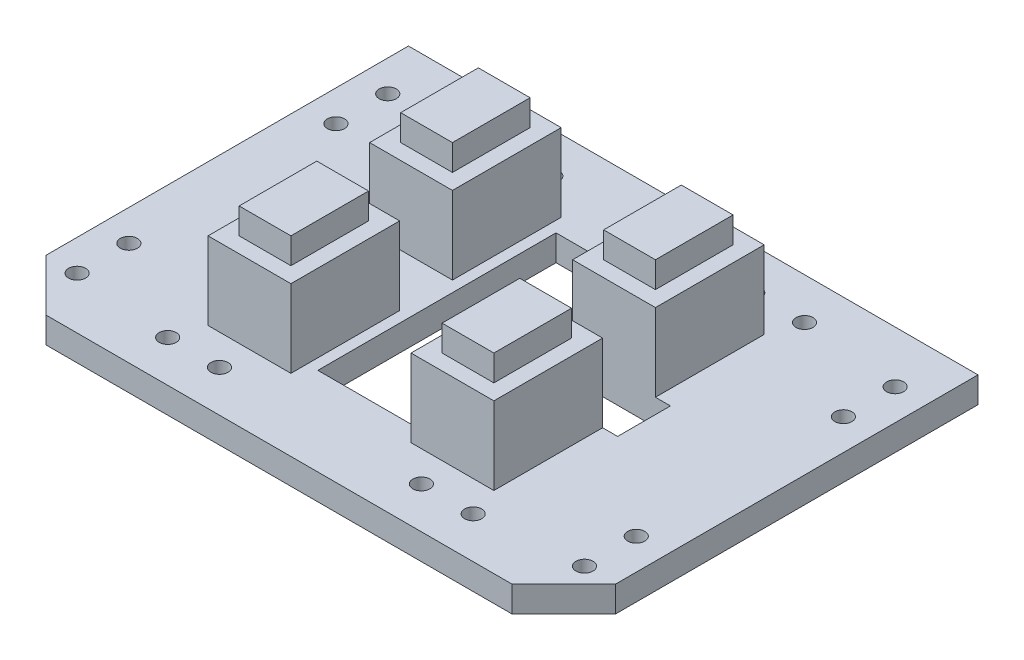
from build123d import *

# Parameters (mm, degrees)
SKETCH1_R           = 1.65
SKETCH1_W           = 19
SKETCH1_H           = 46
BOSS_EXTRUDE3_DEPTH = 5
SKETCH6_W           = 10
SKETCH6_H           = 15
BOSS_EXTRUDE4_DEPTH = 20
SKETCH8_W           = 16
SKETCH8_H           = 21
SKETCH8_W_2         = 10
SKETCH8_H_2         = 15
BOSS_EXTRUDE5_DEPTH = 15
SKETCH5_W           = 16
SKETCH5_H           = 10.2
CUT_EXTRUDE1_DEPTH  = 64.492125496
SKETCH10_W          = 12.5
SKETCH10_H          = 80
SKETCH10_R          = 1.65
BOSS_EXTRUDE6_DEPTH = 5
CHAMFER1_SIZE       = 10


with BuildPart() as part:
    # Sketch1 → Boss-Extrude3 (new body)
    with BuildSketch(Plane(origin=(0, 0, 0), x_dir=(1, 0, 0), z_dir=(0, 1, 0))):
        Polygon((42.5, 40), (-42.5, 40), (-42.5, 24.25), (-42.5, -24.25), (-42.5, -40), (-20, -40), (20, -40), (42.5, -40), (42.5, -24.25), (42.5, 24.25), align=None)
        with Locations((-29.5, -32)):
            Circle(SKETCH1_R, mode=Mode.SUBTRACT)
        with Locations((-19.5, -32)):
            Circle(SKETCH1_R, mode=Mode.SUBTRACT)
        with Locations((19.5, -32)):
            Circle(SKETCH1_R, mode=Mode.SUBTRACT)
        with Locations((29.5, -32)):
            Circle(SKETCH1_R, mode=Mode.SUBTRACT)
        Rectangle(SKETCH1_W, SKETCH1_H, mode=Mode.SUBTRACT)
        with Locations((-29.5, 32)):
            Circle(SKETCH1_R, mode=Mode.SUBTRACT)
        with Locations((-19.5, 32)):
            Circle(SKETCH1_R, mode=Mode.SUBTRACT)
        with Locations((19.5, 32)):
            Circle(SKETCH1_R, mode=Mode.SUBTRACT)
        with Locations((29.5, 32)):
            Circle(SKETCH1_R, mode=Mode.SUBTRACT)
    extrude(amount=BOSS_EXTRUDE3_DEPTH)

    # Sketch6 → Boss-Extrude4 (add)
    with BuildSketch(Plane(origin=(0, 5, 0), x_dir=(1, 0, 0), z_dir=(0, 1, 0))):
        with Locations((-19.6, 15.6)):
            Rectangle(SKETCH6_W, SKETCH6_H)
        with Locations((19.6, 15.6)):
            Rectangle(SKETCH6_W, SKETCH6_H)
        with Locations((19.6, -15.6)):
            Rectangle(SKETCH6_W, SKETCH6_H)
        with Locations((-19.6, -15.6)):
            Rectangle(SKETCH6_W, SKETCH6_H)
    extrude(amount=BOSS_EXTRUDE4_DEPTH)

    # Sketch8 → Boss-Extrude5 (add)
    # profile 1 of 4: a face of its own
    with BuildSketch(Plane(origin=(0, 5, 0), x_dir=(1, 0, 0), z_dir=(0, 1, 0))):
        with Locations((-19.6, 15.6)):
            Rectangle(SKETCH8_W, SKETCH8_H)
        with Locations((-19.6, 15.6)):
            Rectangle(SKETCH8_W_2, SKETCH8_H_2, mode=Mode.SUBTRACT)
    # profile 2 of 4: a face of its own
    with BuildSketch(Plane(origin=(0, 5, 0), x_dir=(1, 0, 0), z_dir=(0, 1, 0))):
        with Locations((-19.6, -15.6)):
            Rectangle(SKETCH8_W, SKETCH8_H)
        with Locations((-19.6, -15.6)):
            Rectangle(SKETCH8_W_2, SKETCH8_H_2, mode=Mode.SUBTRACT)
    # profile 3 of 4: a face of its own
    with BuildSketch(Plane(origin=(0, 5, 0), x_dir=(1, 0, 0), z_dir=(0, 1, 0))):
        with Locations((19.6, 15.6)):
            Rectangle(SKETCH8_W, SKETCH8_H)
        with Locations((19.6, 15.6)):
            Rectangle(SKETCH8_W_2, SKETCH8_H_2, mode=Mode.SUBTRACT)
    # profile 4 of 4: a face of its own
    with BuildSketch(Plane(origin=(0, 5, 0), x_dir=(1, 0, 0), z_dir=(0, 1, 0))):
        with Locations((19.6, -15.6)):
            Rectangle(SKETCH8_W, SKETCH8_H)
        with Locations((19.6, -15.6)):
            Rectangle(SKETCH8_W_2, SKETCH8_H_2, mode=Mode.SUBTRACT)
    extrude(amount=BOSS_EXTRUDE5_DEPTH)

    # Sketch5 → Cut-Extrude1 (cut, through all)
    with BuildSketch(Plane.XZ):
        with Locations((22.5, 0)):
            Rectangle(SKETCH5_W, SKETCH5_H)
    extrude(amount=-CUT_EXTRUDE1_DEPTH, mode=Mode.SUBTRACT)

    # Sketch10 → Boss-Extrude6 (add)
    # profile 1 of 2: a face of its own
    with BuildSketch(Plane(origin=(0, 5, 0), x_dir=(1, 0, 0), z_dir=(0, 1, 0))):
        with Locations((-48.75, 0)):
            Rectangle(SKETCH10_W, SKETCH10_H)
        with Locations((-49, -30)):
            Circle(SKETCH10_R, mode=Mode.SUBTRACT)
        with Locations((-49, -20)):
            Circle(SKETCH10_R, mode=Mode.SUBTRACT)
        with Locations((-49, 20)):
            Circle(SKETCH10_R, mode=Mode.SUBTRACT)
        with Locations((-49, 30)):
            Circle(SKETCH10_R, mode=Mode.SUBTRACT)
    # profile 2 of 2: a face of its own
    with BuildSketch(Plane(origin=(0, 5, 0), x_dir=(1, 0, 0), z_dir=(0, 1, 0))):
        with Locations((48.75, 0)):
            Rectangle(SKETCH10_W, SKETCH10_H)
        with Locations((49, -30)):
            Circle(SKETCH10_R, mode=Mode.SUBTRACT)
        with Locations((49, -20)):
            Circle(SKETCH10_R, mode=Mode.SUBTRACT)
        with Locations((49, 20)):
            Circle(SKETCH10_R, mode=Mode.SUBTRACT)
        with Locations((49, 30)):
            Circle(SKETCH10_R, mode=Mode.SUBTRACT)
    extrude(amount=-BOSS_EXTRUDE6_DEPTH)

    # Chamfer1
    chamfer1_edges = [part.edges().sort_by_distance(p)[0] for p in [
        (55, 2.5, 40),
        (-55, 2.5, 40),
    ]]
    chamfer(chamfer1_edges, length=CHAMFER1_SIZE)


solid = part.part
